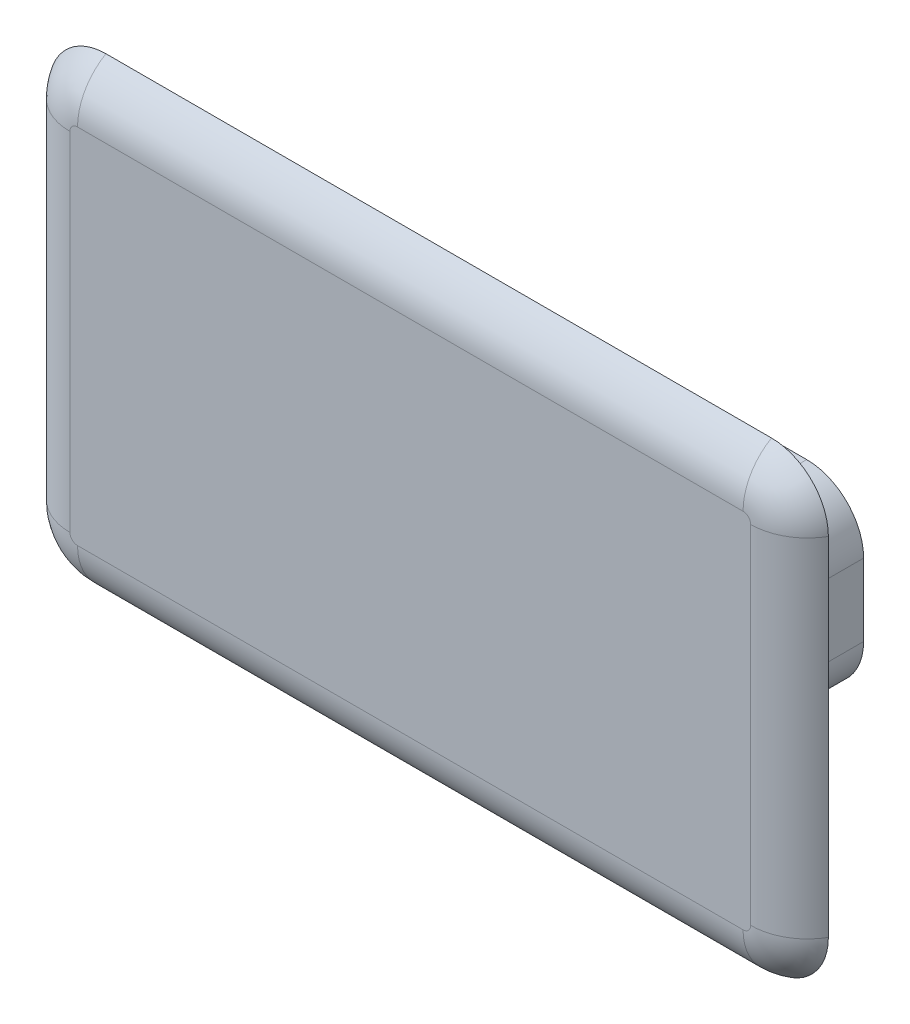
from build123d import *

# Parameters (mm, degrees)
SKETCH1_W           = 13.701960198
SKETCH1_H           = 8.105384906
BOSS_EXTRUDE1_DEPTH = 3
CAVITY1_OUTLINE_W   = 13.701960198
CAVITY1_OUTLINE_H   = 8.105384906
CAVITY1_DEPTH       = 2.5
CUT_EXTRUDE1_DEPTH  = 1.5
FILLET1_R           = 1
FILLET2_R           = 1


with BuildPart() as part:
    # Sketch1 → Boss-Extrude1 (new body)
    with BuildSketch(Plane.XY):
        with Locations((6.850980099, 4.052692453)):
            Rectangle(SKETCH1_W, SKETCH1_H)
    extrude(amount=BOSS_EXTRUDE1_DEPTH)

    # Cavity1: read off the stored shape, not the designer's step
    # Cavity1 outline → Cavity1 (cut)
    with BuildSketch(Plane.XY):
        with Locations((6.850980099, 4.052692453)):
            Rectangle(CAVITY1_OUTLINE_W, CAVITY1_OUTLINE_H)
        with BuildLine():
            Line((11.821561481, 4.585876247), (11.821561481, 3.315876247))
            ThreePointArc((11.821561481, 3.315876247), (11.528668262, 2.608769466), (10.821561481, 2.315876247))
            Line((10.821561481, 2.315876247), (4.051561481, 2.315876247))
            ThreePointArc((4.051561481, 2.315876247), (3.3444547, 2.608769466), (3.051561481, 3.315876247))
            Line((3.051561481, 3.315876247), (3.051561481, 4.585876247))
            ThreePointArc((3.051561481, 4.585876247), (3.3444547, 5.292983028), (4.051561481, 5.585876247))
            Line((4.051561481, 5.585876247), (10.821561481, 5.585876247))
            ThreePointArc((10.821561481, 5.585876247), (11.528668262, 5.292983028), (11.821561481, 4.585876247))
        make_face(mode=Mode.SUBTRACT)
    extrude(amount=CAVITY1_DEPTH, mode=Mode.SUBTRACT)

    # Cavity1 2: loft between two sections, ruled curve by curve
    cavity1_2_from = [
        Edge.make_three_point_arc((3.051561481, 3.315876247, 2.2), (3.3444547, 2.608769466, 2.2), (4.051561481, 2.315876247, 2.2)),
        Edge.make_three_point_arc((4.051561481, 5.585876247, 2.2), (3.3444547, 5.292983028, 2.2), (3.051561481, 4.585876247, 2.2)),
        Edge.make_three_point_arc((10.821561481, 2.315876247, 2.2), (11.528668262, 2.608769466, 2.2), (11.821561481, 3.315876247, 2.2)),
        Edge.make_three_point_arc((11.821561481, 4.585876247, 2.2), (11.528668262, 5.292983028, 2.2), (10.821561481, 5.585876247, 2.2)),
        Edge.make_line((3.051561481, 4.585876247, 2.2), (3.051561481, 3.315876247, 2.2)),
        Edge.make_line((4.051561481, 2.315876247, 2.2), (10.821561481, 2.315876247, 2.2)),
        Edge.make_line((4.051561481, 5.585876247, 2.2), (10.821561481, 5.585876247, 2.2)),
        Edge.make_line((11.821561481, 3.315876247, 2.2), (11.821561481, 4.585876247, 2.2)),
    ]
    cavity1_2_to = [
        Edge.make_three_point_arc((2.751561481, 3.315876247, 2.5), (3.132322665, 2.396637431, 2.5), (4.051561481, 2.015876247, 2.5)),
        Edge.make_three_point_arc((4.051561481, 5.885876247, 2.5), (3.132322665, 5.505115063, 2.5), (2.751561481, 4.585876247, 2.5)),
        Edge.make_three_point_arc((10.821561481, 2.015876247, 2.5), (11.740800297, 2.396637431, 2.5), (12.121561481, 3.315876247, 2.5)),
        Edge.make_three_point_arc((12.121561481, 4.585876247, 2.5), (11.740800297, 5.505115063, 2.5), (10.821561481, 5.885876247, 2.5)),
        Edge.make_line((2.751561481, 4.585876247, 2.5), (2.751561481, 3.315876247, 2.5)),
        Edge.make_line((4.051561481, 2.015876247, 2.5), (10.821561481, 2.015876247, 2.5)),
        Edge.make_line((4.051561481, 5.885876247, 2.5), (10.821561481, 5.885876247, 2.5)),
        Edge.make_line((12.121561481, 3.315876247, 2.5), (12.121561481, 4.585876247, 2.5)),
    ]
    cavity1_2 = Solid(Shell([*[Face.make_surface_from_curves(cavity1_2_from[k], cavity1_2_to[k]) for k in range(8)], Face(Wire(cavity1_2_from)), Face(Wire(cavity1_2_to))]))
    add(cavity1_2)

    # Sketch2 → Cut-Extrude1 (cut)
    with BuildSketch(Plane(origin=(0, 0, 0), x_dir=(-1, 0, 0), z_dir=(0, 0, -1))):
        with BuildLine():
            Line((-3.851561481, 3.315876247), (-3.851561481, 4.585876247))
            ThreePointArc((-3.851561481, 4.585876247), (-3.910140125, 4.727297603), (-4.051561481, 4.785876247))
            Line((-4.051561481, 4.785876247), (-10.821561481, 4.785876247))
            ThreePointArc((-10.821561481, 4.785876247), (-10.962982837, 4.727297603), (-11.021561481, 4.585876247))
            Line((-11.021561481, 4.585876247), (-11.021561481, 3.315876247))
            ThreePointArc((-11.021561481, 3.315876247), (-10.962982837, 3.174454891), (-10.821561481, 3.115876247))
            Line((-10.821561481, 3.115876247), (-4.051561481, 3.115876247))
            ThreePointArc((-4.051561481, 3.115876247), (-3.910140125, 3.174454891), (-3.851561481, 3.315876247))
        make_face()
    extrude(amount=-CUT_EXTRUDE1_DEPTH, mode=Mode.SUBTRACT)

    # Fillet1
    fillet1_edges = [part.edges().sort_by_distance(p)[0] for p in [
        (0, 8.105384906, 2.75),
        (13.701960198, 8.105384906, 2.75),
        (13.701960198, 0, 2.75),
        (0, 0, 2.75),
    ]]
    fillet(fillet1_edges, radius=FILLET1_R)

    # Fillet2
    # the kernel refuses this fillet: 1 mm, written as the material it takes off along each edge
    with BuildSketch(Plane(origin=(1, 1, 3), x_dir=(-1, 0, 0), z_dir=(0, 1, 0))) as fillet2_piece_1:
        with BuildLine():
            CenterArc((0.133974596, -1), FILLET2_R, 30, 60)
            Line((0.133974596, 0), (0.133974596, 0.02))
            Line((0.133974596, 0.02), (1, 0.02))
            Line((1, 0.02), (1.02, 0))
            ThreePointArc((1.02, 0), (1.02, -0.25), (1.017320508, -0.49))
            Line((1.017320508, -0.49), (1, -0.5))
        make_face()
    revolve(axis=Axis((1, 1, 3), (0, 0, 1)), revolution_arc=90, mode=Mode.SUBTRACT)
    with BuildSketch(Plane(origin=(0, 7.105384906, 3), x_dir=(0, 0, -1), z_dir=(0, -1, 0)), Plane(origin=(13.701960198, 1, 3), x_dir=(-5.230269550793082e-10, 0, -1.0), z_dir=(0, 1, 0))) as fillet2_piece_2:
        with BuildLine():
            CenterArc((1, 0.866025404), FILLET2_R, 180, 60)
            Line((0, 0.866025404), (-0.02, 0.866025404))
            Line((-0.02, 0.866025404), (-0.02, 0))
            Line((-0.02, 0), (0, -0.02))
            ThreePointArc((0, -0.02), (0.25, -0.02), (0.49, -0.017320508))
            Line((0.49, -0.017320508), (0.5, 0))
        make_face()
    extrude(amount=6.105384906, mode=Mode.SUBTRACT)
    with BuildSketch(Plane(origin=(1, 7.105384906, 3), x_dir=(-1, 0, 0), z_dir=(0, -1, 0))) as fillet2_piece_3:
        with BuildLine():
            CenterArc((0.133974596, 1), FILLET2_R, 270, 60)
            Line((0.133974596, 0), (0.133974596, -0.02))
            Line((0.133974596, -0.02), (1, -0.02))
            Line((1, -0.02), (1.02, 0))
            ThreePointArc((1.02, 0), (1.02, 0.25), (1.017320508, 0.49))
            Line((1.017320508, 0.49), (1, 0.5))
        make_face()
    revolve(axis=Axis((1, 7.105384906, 3), (0, 0, -1)), revolution_arc=90, mode=Mode.SUBTRACT)
    with BuildSketch(Plane(origin=(12.701960198, 8.105384906, 3), x_dir=(0, -2.7725377549357952e-11, -1.0), z_dir=(-1, 0, 0)), Plane(origin=(1, 0, 3), x_dir=(0, 0, -1), z_dir=(1, 0, 0))) as fillet2_piece_4:
        with BuildLine():
            CenterArc((1, 0.866025404), FILLET2_R, 179.999999998, 60)
            Line((0, 0.866025404), (-0.02, 0.866025404))
            Line((-0.02, 0.866025404), (-0.02, 0))
            Line((-0.02, 0), (0, -0.02))
            ThreePointArc((0, -0.02), (0.25, -0.02), (0.49, -0.017320508))
            Line((0.49, -0.017320508), (0.5, 0))
        make_face()
    extrude(amount=11.701960198, mode=Mode.SUBTRACT)
    with BuildSketch(Plane(origin=(12.701960198, 7.105384906, 3), x_dir=(0, 1, 0), z_dir=(-1, 0, 0))) as fillet2_piece_5:
        with BuildLine():
            CenterArc((0.133974596, 1), FILLET2_R, 270, 60)
            Line((0.133974596, 0), (0.133974596, -0.02))
            Line((0.133974596, -0.02), (1, -0.02))
            Line((1, -0.02), (1.02, 0))
            ThreePointArc((1.02, 0), (1.02, 0.25), (1.017320508, 0.49))
            Line((1.017320508, 0.49), (1, 0.5))
        make_face()
    revolve(axis=Axis((12.701960198, 7.105384906, 3), (0, 0, -1)), revolution_arc=90, mode=Mode.SUBTRACT)
    with BuildSketch(Plane(origin=(12.701960198, 1, 3), x_dir=(0, -1, 0), z_dir=(-1, 0, 0))) as fillet2_piece_6:
        with BuildLine():
            CenterArc((0.133974596, -1), FILLET2_R, 30, 60)
            Line((0.133974596, 0), (0.133974596, 0.02))
            Line((0.133974596, 0.02), (1, 0.02))
            Line((1, 0.02), (1.02, 0))
            ThreePointArc((1.02, 0), (1.02, -0.25), (1.017320508, -0.49))
            Line((1.017320508, -0.49), (1, -0.5))
        make_face()
    revolve(axis=Axis((12.701960198, 1, 3), (0, 0, 1)), revolution_arc=90, mode=Mode.SUBTRACT)


solid = part.part
